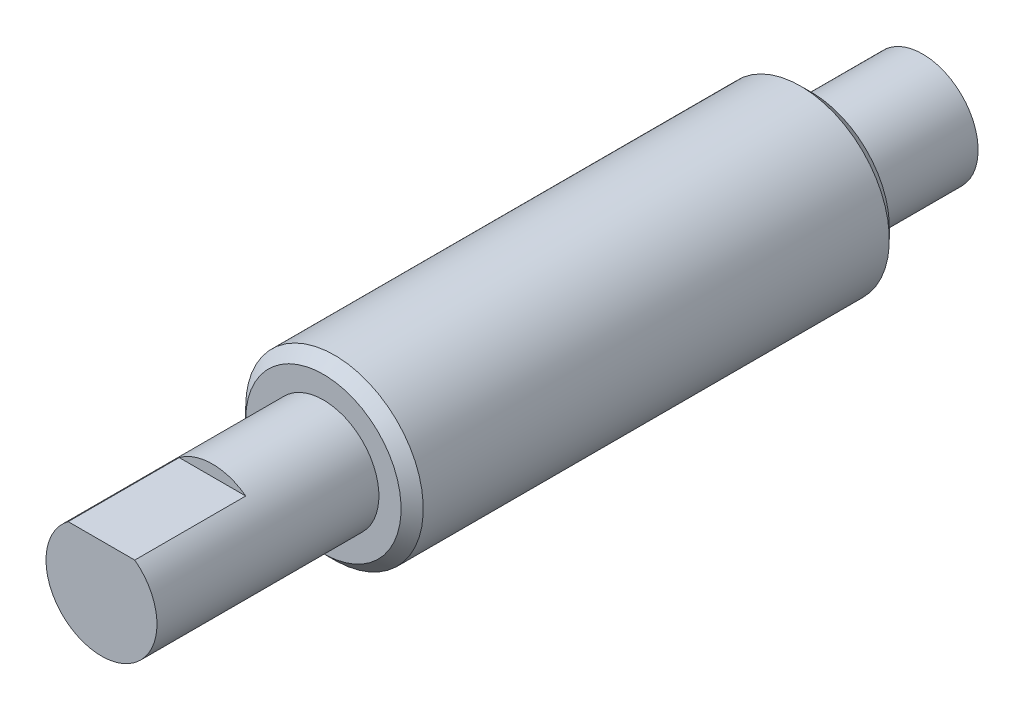
from build123d import *

# Parameters (mm, degrees)
CUT_EXTRUDE1_START = -10
CUT_EXTRUDE1_DEPTH = 10


with BuildPart() as part:
    # Sketch1 → Revolve1 (revolve)
    with BuildSketch(Plane(origin=(0, 0, 0), x_dir=(1, 0, 0), z_dir=(0, 1, 0))):
        Polygon((0, 74), (0, 0), (5, 0), (5, 20), (7, 20), (8, 21), (8, 63), (7, 64), (5, 64), (5, 74), align=None)
    revolve(axis=Axis((0, 0, -74), (0, 0, 1)))

    # Sketch2 → Cut-Extrude1 (cut)
    with BuildSketch(Plane.XY.offset(CUT_EXTRUDE1_START)):
        with BuildLine():
            Line((-3, 4), (3, 4))
            ThreePointArc((3, 4), (0, 5), (-3, 4))
        make_face()
    extrude(amount=CUT_EXTRUDE1_DEPTH, mode=Mode.SUBTRACT)


solid = part.part
